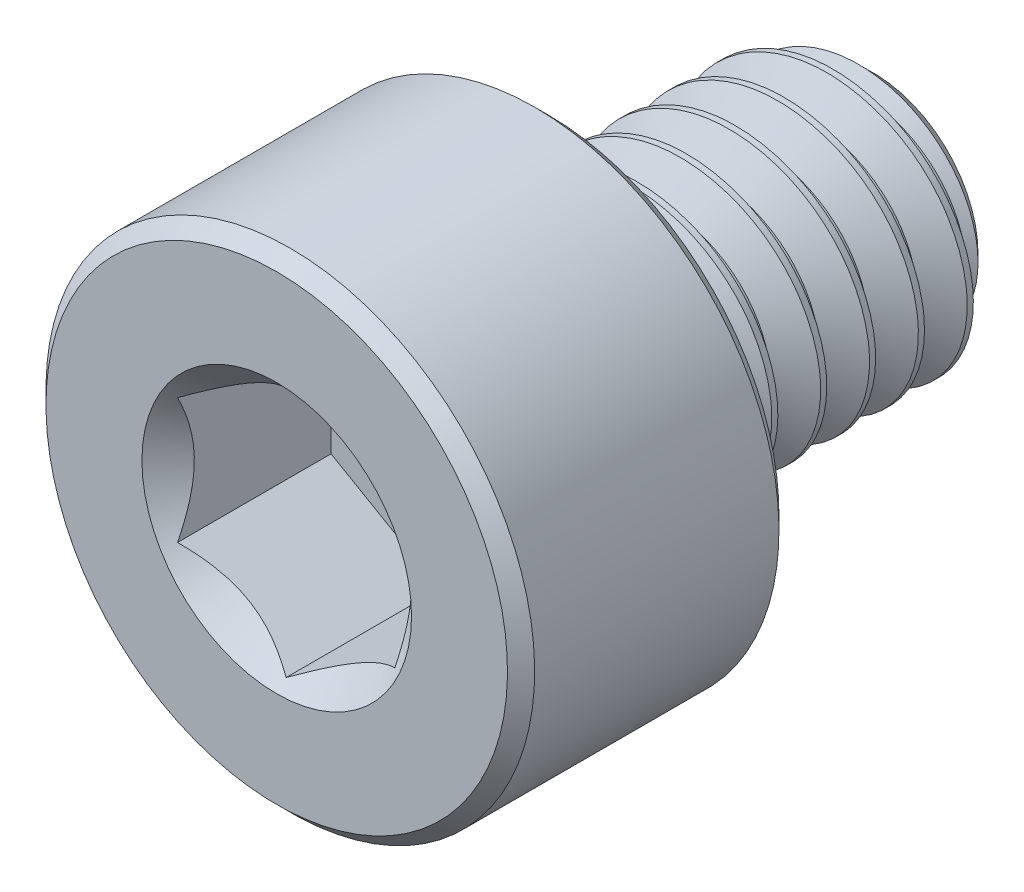
from build123d import *

# Parameters (mm, degrees)
CUT_EXTRUDE1_DEPTH     = 1.5
SPLIT1_SURFACE_1_BACK  = 9.411
SPLIT1_SURFACE_1_DEPTH = 18.822
SPLIT1_SURFACE_2_BACK  = 9.411
SPLIT1_SURFACE_2_DEPTH = 18.822
CUT_SWEEP1_PITCH       = 0.45


with BuildPart() as part:
    # Sketch2 → Revolve1 (revolve)
    with BuildSketch(Plane(origin=(0, 0, 0), x_dir=(0, 0, -1), z_dir=(1, 0, 0))):
        with BuildLine():
            Line((-2.75, 0), (-2.75, 2.125))
            Line((-2.75, 2.125), (-2.625, 2.25))
            Line((-2.625, 2.25), (-0.375, 2.25))
            Line((-0.375, 2.25), (-0.25, 2.125))
            Line((-0.25, 2.125), (-0.25, 1.375))
            ThreePointArc((-0.25, 1.375), (-0.213388348, 1.286611652), (-0.125, 1.25))
            Line((-0.125, 1.25), (2.457716426, 1.25))
            Line((2.457716426, 1.25), (2.75, 0.957716426))
            Line((2.75, 0.957716426), (2.75, 0))
            Line((2.75, 0), (-2.75, 0))
        make_face()
    revolve(axis=Axis((0, 0, -2.75), (0, 0, 1)))

    # Sketch3 → Cut-Extrude1 (cut)
    with BuildSketch(Plane.XY.offset(2.75)):
        Polygon((1, -0.577350269), (1, 0.577350269), (0, 1.154700538), (-1, 0.577350269), (-1, -0.577350269), (0, -1.154700538), align=None)
    extrude(amount=-CUT_EXTRUDE1_DEPTH, mode=Mode.SUBTRACT)

    # Cut-Extrude2 cone 1 section (through the dimple's axis) → Cut-Extrude2 (revolve, cut)
    with BuildSketch(Plane(origin=(0, 0, 2.75), x_dir=(0, -1, 0), z_dir=(1, 0, 0))):
        Polygon((0, 0), (1.241303079, 0), (0, 1.241303079), align=None)
    revolve(axis=Axis((0, 0, 2.75), (0, 0, -1)), mode=Mode.SUBTRACT)


with BuildPart() as body_2:
    # Split1: the piece behind the surface
    add(part.part)
    # Split1 surface: a surface, the sketch's curves swept straight by 18.822 mm
    with BuildLine(Plane(origin=(0, 0, 0), x_dir=(0, 0, -1), z_dir=(1, 0, 0)).offset(-SPLIT1_SURFACE_1_BACK), mode=Mode.PRIVATE) as split1_surface_1_path:
        Line((-0.125, -2.25), (-0.125, 2.25))
    split1_surface_1 = Shell.extrude(split1_surface_1_path.wire(), (1 * SPLIT1_SURFACE_1_DEPTH, 0 * SPLIT1_SURFACE_1_DEPTH, 0 * SPLIT1_SURFACE_1_DEPTH))
    split(bisect_by=split1_surface_1, keep=Keep.BOTTOM)

    # Cut-Sweep1: the profile of Sketch7 screwed along a right-hand helix of 7.666667 turns, 6 arcs to a turn; built about Z, then put on its axis
    cut_sweep1_z = Axis((0, 0, 0), (0, 0, 1))
    cut_sweep1_corners = [(1.274356964, 0, 0.0140625), (1.274356964, 0, -0.4078125), (0.957716426, 0, -0.225), (0.957716426, 0, -0.16875)]
    with BuildLine(mode=Mode.PRIVATE) as cut_sweep1_profile:
        Line(cut_sweep1_corners[0], cut_sweep1_corners[1])
        Line(cut_sweep1_corners[1], cut_sweep1_corners[2])
        Line(cut_sweep1_corners[2], cut_sweep1_corners[3])
        Line(cut_sweep1_corners[3], cut_sweep1_corners[0])
    cut_sweep1_cap = Face(cut_sweep1_profile.wire())
    cut_sweep1_turn_angles = [0, 30, 60, 90, 120, 150, 180, 210, 240, 270, 300, 330, 360]
    cut_sweep1_turn_weights = [1, 0.8660254037844387, 1, 0.8660254037844387, 1, 0.8660254037844387, 1, 0.8660254037844387, 1, 0.8660254037844387, 1, 0.8660254037844387, 1]
    cut_sweep1_turn_rails = [Edge.make_bspline([Vector(p[0], p[1], 0).rotate(cut_sweep1_z, cut_sweep1_turn_angles[k]) / cut_sweep1_turn_weights[k] + Vector(0, 0, p[2] + CUT_SWEEP1_PITCH * cut_sweep1_turn_angles[k] / 360) for k in range(13)], [0, 0, 0, 1, 1, 2, 2, 3, 3, 4, 4, 5, 5, 6, 6, 6], 2, cut_sweep1_turn_weights) for p in cut_sweep1_corners]
    cut_sweep1_turn_sides = [Face.make_surface_from_curves(cut_sweep1_turn_rails[p[0]], cut_sweep1_turn_rails[p[1]]) for p in [(0, 1), (1, 2), (2, 3), (3, 0)]]
    cut_sweep1_last_angles = [2520, 2550, 2580, 2610, 2640, 2670, 2700, 2730, 2760]
    cut_sweep1_last_weights = [1, 0.8660254037844387, 1, 0.8660254037844387, 1, 0.8660254037844387, 1, 0.8660254037844208, 1]
    cut_sweep1_last_rails = [Edge.make_bspline([Vector(p[0], p[1], 0).rotate(cut_sweep1_z, cut_sweep1_last_angles[k]) / cut_sweep1_last_weights[k] + Vector(0, 0, p[2] + CUT_SWEEP1_PITCH * cut_sweep1_last_angles[k] / 360) for k in range(9)], [0, 0, 0, 1, 1, 2, 2, 3, 3, 4, 4, 4], 2, cut_sweep1_last_weights) for p in cut_sweep1_corners]
    cut_sweep1_last_sides = [Face.make_surface_from_curves(cut_sweep1_last_rails[p[0]], cut_sweep1_last_rails[p[1]]) for p in [(0, 1), (1, 2), (2, 3), (3, 0)]]
    cut_sweep1 = Plane(origin=(0, 0, -2.75), x_dir=(0, 1, 0), z_dir=(0, 0, 1)) * Solid(Shell([*[p.moved(Location((0, 0, CUT_SWEEP1_PITCH * i))) for i in range(7) for p in cut_sweep1_turn_sides], *cut_sweep1_last_sides, cut_sweep1_cap, cut_sweep1_cap.rotate(cut_sweep1_z, 2760).moved(Location((0, 0, CUT_SWEEP1_PITCH * 2760 / 360)))]))
    add(cut_sweep1, mode=Mode.SUBTRACT)


with BuildPart() as part_1:
    add(part.part)

    # Split1: split by a surface, the side it looks to stays
    # Split1 surface: a surface, the sketch's curves swept straight by 18.822 mm
    with BuildLine(Plane(origin=(0, 0, 0), x_dir=(0, 0, -1), z_dir=(1, 0, 0)).offset(-SPLIT1_SURFACE_2_BACK), mode=Mode.PRIVATE) as split1_surface_2_path:
        Line((-0.125, -2.25), (-0.125, 2.25))
    split1_surface_2 = Shell.extrude(split1_surface_2_path.wire(), (1 * SPLIT1_SURFACE_2_DEPTH, 0 * SPLIT1_SURFACE_2_DEPTH, 0 * SPLIT1_SURFACE_2_DEPTH))
    split(bisect_by=split1_surface_2, keep=Keep.TOP)

    add(body_2.part)  # Revolve2 merges body 2
    # Sketch8 → Revolve2 (revolve)
    with BuildSketch(Plane(origin=(0, 0, 0), x_dir=(0, 0, -1), z_dir=(1, 0, 0)), mode=Mode.PRIVATE) as revolve2_sk:
        Polygon((-0.25, 0), (-0.25, 1.25), (-0.125, 1.25), (0.596687836, 0), align=None)
    revolve(revolve2_sk.sketch.rotate(Axis((0, 0, -0.596687836), (0, 0, 1)), 270), axis=Axis((0, 0, -0.596687836), (0, 0, 1)))


solid = part_1.part
